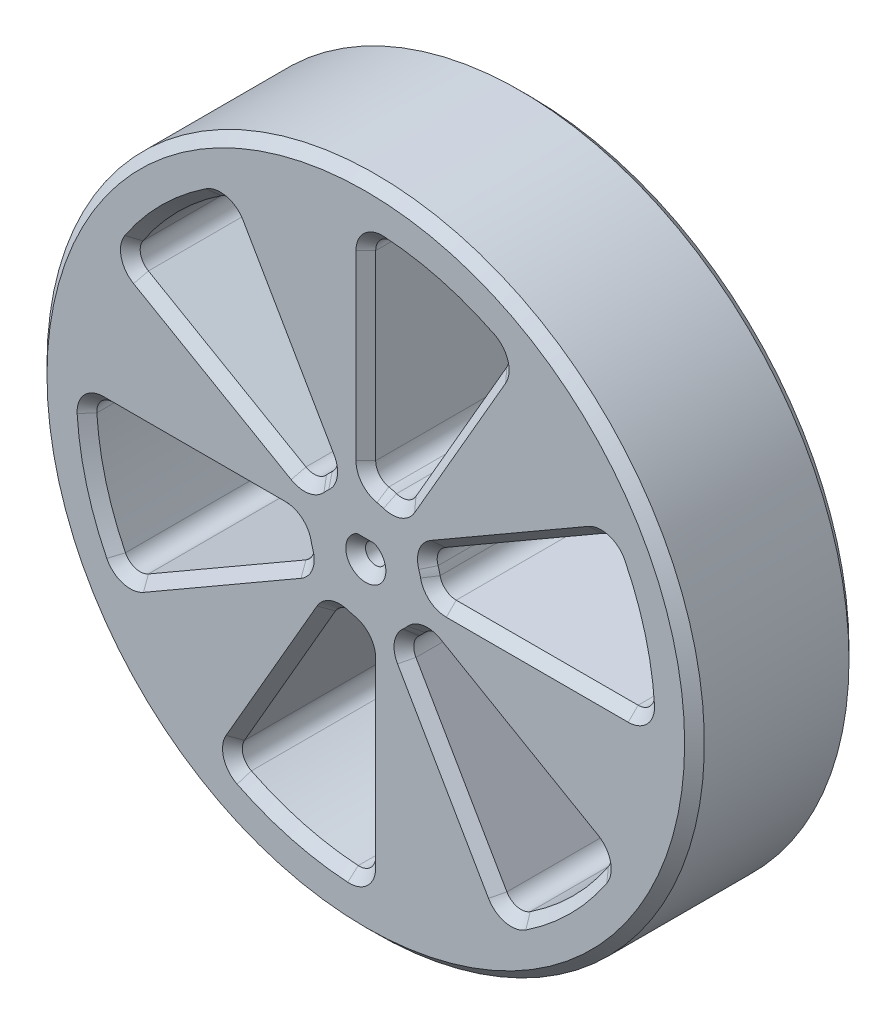
from build123d import *

# Parameters (mm, degrees)
SKETCH1_R           = 100
BOSS_EXTRUDE1_DEPTH = 50
CUT_EXTRUDE1_DEPTH  = 151
CIRPATTERN1_COUNT   = 6
FILLET1_R           = 5
CUT_EXTRUDE2_DEPTH  = 151
CHAMFER1_SIZE       = 3


with BuildPart() as part:
    # Sketch1 → Boss-Extrude1 (new body)
    with BuildSketch(Plane.XY):
        Circle(SKETCH1_R)
    extrude(amount=BOSS_EXTRUDE1_DEPTH)

    # Sketch2 → Cut-Extrude1 (cut, through all)
    with BuildSketch(Plane.XY.offset(50)):
        with BuildLine():
            Line((0, 85), (0, 20))
            ThreePointArc((0, 20), (5.176380902, 19.318516526), (10, 17.320508076))
            Line((10, 17.320508076), (42.5, 73.612159322))
            ThreePointArc((42.5, 73.612159322), (21.999618834, 82.103695235), (0, 85))
        make_face()
    cut_extrude1 = extrude(amount=-CUT_EXTRUDE1_DEPTH, mode=Mode.SUBTRACT)

    # CirPattern1: Cut-Extrude1 ×6 about axis
    cirpattern1_axis = Axis((0, 0, 50), (0, 0, -1))
    for i in range(1, CIRPATTERN1_COUNT):
        add(cut_extrude1.rotate(cirpattern1_axis, i * 360 / CIRPATTERN1_COUNT), mode=Mode.SUBTRACT)

    # Fillet1
    fillet1_edges = [part.edges().sort_by_distance(p)[0] for p in [
        (0, 85, 25),
        (42.5, 73.612159322, 25),
        (10, 17.320508076, 25),
        (-17.320508076, 10, 25),
        (-73.612159322, 42.5, 25),
        (-42.5, 73.612159322, 25),
        (-10, 17.320508076, 25),
        (0, -20, 25),
        (0, -85, 25),
        (-42.5, -73.612159322, 25),
        (-10, -17.320508076, 25),
        (-17.320508076, -10, 25),
        (-73.612159322, -42.5, 25),
        (-85, 0, 25),
        (-20, 0, 25),
        (17.320508076, -10, 25),
        (73.612159322, -42.5, 25),
        (42.5, -73.612159322, 25),
        (10, -17.320508076, 25),
        (17.320508076, 10, 25),
        (73.612159322, 42.5, 25),
        (85, 0, 25),
        (20, 0, 25),
        (0, 20, 25),
    ]]
    fillet(fillet1_edges, radius=FILLET1_R)

    # Sketch3 → Cut-Extrude2 (cut, through all)
    with BuildSketch(Plane.XY.offset(50)):
        with BuildLine():
            Line((1.833030278, 2.5), (-1.833030278, 2.5))
            ThreePointArc((-1.833030278, 2.5), (-1.401357581, -2.76517575), (3.1, 0))
            ThreePointArc((3.1, 0), (2.76517575, 1.401357581), (1.833030278, 2.5))
        make_face()
    extrude(amount=-CUT_EXTRUDE2_DEPTH, mode=Mode.SUBTRACT)

    # Chamfer1
    chamfer1_edges = [part.edges().sort_by_distance(p)[0] for p in [
        (-100, 0, 50),
        (40.378479311, 73.091045731, 50),
        (21.999618834, 82.103695235, 50),
        (1.576734016, 83.487942048, 50),
        (0, 52.169247271, 50),
        (1.127016654, 21.332619768, 50),
        (5.176380902, 19.318516526, 50),
        (9.690284831, 19.038098975, 50),
        (26.084623635, 45.179893433, 50),
        (-43.109462736, 71.514311715, 50),
        (-60.104076401, 60.104076401, 50),
        (-71.514311715, 43.109462736, 50),
        (-45.179893433, 26.084623635, 50),
        (-17.911082321, 11.642334937, 50),
        (-14.142135624, 14.142135624, 50),
        (-11.642334937, 17.911082321, 50),
        (-26.084623635, 45.179893433, 50),
        (-40.378479311, -73.091045731, 50),
        (-21.999618834, -82.103695235, 50),
        (-1.576734016, -83.487942048, 50),
        (0, -52.169247271, 50),
        (-1.127016654, -21.332619768, 50),
        (-5.176380902, -19.318516526, 50),
        (-9.690284831, -19.038098975, 50),
        (-26.084623635, -45.179893433, 50),
        (-83.487942048, -1.576734016, 50),
        (-82.103695235, -21.999618834, 50),
        (-73.091045731, -40.378479311, 50),
        (-45.179893433, -26.084623635, 50),
        (-19.038098975, -9.690284831, 50),
        (-19.318516526, -5.176380902, 50),
        (-21.332619768, -1.127016654, 50),
        (-52.169247271, 0, 50),
        (43.109462736, -71.514311715, 50),
        (60.104076401, -60.104076401, 50),
        (71.514311715, -43.109462736, 50),
        (45.179893433, -26.084623635, 50),
        (17.911082321, -11.642334937, 50),
        (14.142135624, -14.142135624, 50),
        (11.642334937, -17.911082321, 50),
        (26.084623635, -45.179893433, 50),
        (83.487942048, 1.576734016, 50),
        (82.103695235, 21.999618834, 50),
        (73.091045731, 40.378479311, 50),
        (45.179893433, 26.084623635, 50),
        (19.038098975, 9.690284831, 50),
        (19.318516526, 5.176380902, 50),
        (21.332619768, 1.127016654, 50),
        (52.169247271, 0, 50),
        (0, 2.5, 50),
        (0, -3.1, 50),
        (-100, 0, 0),
        (1.127016654, 21.332619768, 0),
        (0, 52.169247271, 0),
        (1.576734016, 83.487942048, 0),
        (21.999618834, 82.103695235, 0),
        (40.378479311, 73.091045731, 0),
        (26.084623635, 45.179893433, 0),
        (9.690284831, 19.038098975, 0),
        (5.176380902, 19.318516526, 0),
        (-17.911082321, 11.642334937, 0),
        (-45.179893433, 26.084623635, 0),
        (-71.514311715, 43.109462736, 0),
        (-60.104076401, 60.104076401, 0),
        (-43.109462736, 71.514311715, 0),
        (-26.084623635, 45.179893433, 0),
        (-11.642334937, 17.911082321, 0),
        (-14.142135624, 14.142135624, 0),
        (-1.127016654, -21.332619768, 0),
        (0, -52.169247271, 0),
        (-1.576734016, -83.487942048, 0),
        (-21.999618834, -82.103695235, 0),
        (-40.378479311, -73.091045731, 0),
        (-26.084623635, -45.179893433, 0),
        (-9.690284831, -19.038098975, 0),
        (-5.176380902, -19.318516526, 0),
        (-19.038098975, -9.690284831, 0),
        (-45.179893433, -26.084623635, 0),
        (-73.091045731, -40.378479311, 0),
        (-82.103695235, -21.999618834, 0),
        (-83.487942048, -1.576734016, 0),
        (-52.169247271, 0, 0),
        (-21.332619768, -1.127016654, 0),
        (-19.318516526, -5.176380902, 0),
        (17.911082321, -11.642334937, 0),
        (45.179893433, -26.084623635, 0),
        (71.514311715, -43.109462736, 0),
        (60.104076401, -60.104076401, 0),
        (43.109462736, -71.514311715, 0),
        (26.084623635, -45.179893433, 0),
        (11.642334937, -17.911082321, 0),
        (14.142135624, -14.142135624, 0),
        (19.038098975, 9.690284831, 0),
        (45.179893433, 26.084623635, 0),
        (73.091045731, 40.378479311, 0),
        (82.103695235, 21.999618834, 0),
        (83.487942048, 1.576734016, 0),
        (52.169247271, 0, 0),
        (21.332619768, 1.127016654, 0),
        (19.318516526, 5.176380902, 0),
        (0, -3.1, 0),
        (0, 2.5, 0),
    ]]
    chamfer(chamfer1_edges, length=CHAMFER1_SIZE)


solid = part.part
